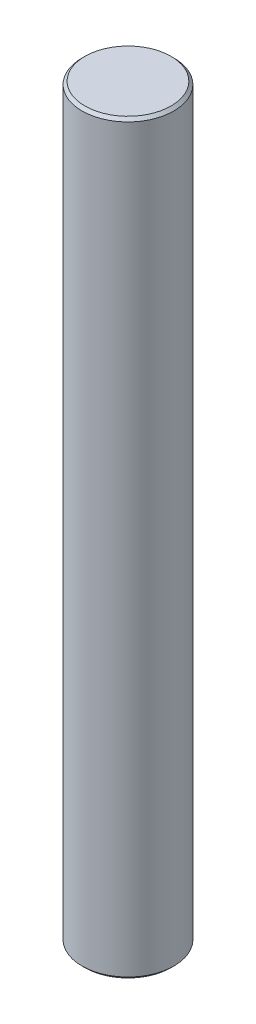
from build123d import *

# Parameters (mm, degrees)
SKETCH1_R           = 4
BOSS_EXTRUDE1_DEPTH = 65
CHAMFER1_SIZE       = 0.25


with BuildPart() as part:
    # Sketch1 → Boss-Extrude1 (new body)
    with BuildSketch(Plane(origin=(0, 0, 0), x_dir=(1, 0, 0), z_dir=(0, 1, 0))):
        Circle(SKETCH1_R)
    extrude(amount=BOSS_EXTRUDE1_DEPTH)

    # Chamfer1
    chamfer1_edges = [part.edges().sort_by_distance(p)[0] for p in [
        (-4, 0, 0),
        (-4, 65, 0),
    ]]
    chamfer(chamfer1_edges, length=CHAMFER1_SIZE)


solid = part.part
